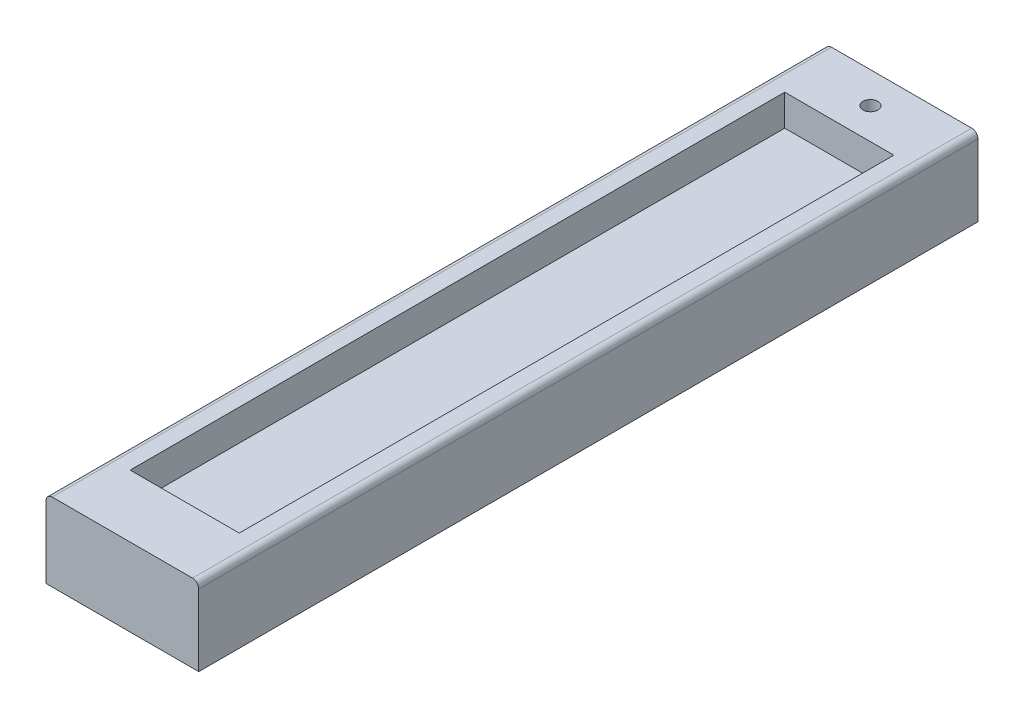
from build123d import *

# Parameters (mm, degrees)
SKETCH1_W               = 49
SKETCH1_H               = 20
BOSS_EXTRUDE1_DEPTH     = 125
SKETCH3_W               = 49
SKETCH3_H               = 250
BOSS_EXTRUDE2_DEPTH     = 5
CUT_EXTRUDE1_DEPTH      = 130.808512818
CUT_EXTRUDE1_DEPTH_BACK = 10
SKETCH2_R               = 2.4
SKETCH5_W               = 35
SKETCH5_H               = 210
CUT_EXTRUDE3_DEPTH      = 10
FILLET1_R               = 2
SKETCH4_R               = 7.874
CUT_EXTRUDE2_DEPTH      = 10


with BuildPart() as part:
    # Sketch1 → Boss-Extrude1 (new, symmetric)
    with BuildSketch(Plane.XY):
        Rectangle(SKETCH1_W, SKETCH1_H)
    extrude(amount=BOSS_EXTRUDE1_DEPTH, both=True)

    # Sketch3 → Boss-Extrude2 (add)
    with BuildSketch(Plane(origin=(0, 10, 0), x_dir=(1, 0, 0), z_dir=(0, 1, 0))):
        Rectangle(SKETCH3_W, SKETCH3_H)
    extrude(amount=BOSS_EXTRUDE2_DEPTH)

    # Sketch2 → Cut-Extrude1 (cut, two sides: drawn at the far end of the back side and taken through both)
    with BuildSketch(Plane(origin=(0, 15, 0), x_dir=(1, 0, 0), z_dir=(0, 1, 0)).offset(-CUT_EXTRUDE1_DEPTH_BACK)):
        with Locations((0, 115)):
            Circle(SKETCH2_R)
    extrude(amount=CUT_EXTRUDE1_DEPTH + CUT_EXTRUDE1_DEPTH_BACK, mode=Mode.SUBTRACT)

    # Sketch5 → Cut-Extrude3 (cut)
    with BuildSketch(Plane(origin=(0, 15, 0), x_dir=(1, 0, 0), z_dir=(0, 1, 0))):
        Rectangle(SKETCH5_W, SKETCH5_H)
    extrude(amount=-CUT_EXTRUDE3_DEPTH, mode=Mode.SUBTRACT)

    # Fillet1
    fillet1_edges = [part.edges().sort_by_distance(p)[0] for p in [
        (-24.5, 15, 0),
        (24.5, 15, 0),
    ]]
    fillet(fillet1_edges, radius=FILLET1_R)

    # Sketch4 → Cut-Extrude2 (cut)
    with BuildSketch(Plane.XZ.offset(10)):
        with Locations((-0.5, 110)):
            Circle(SKETCH4_R)
    extrude(amount=-CUT_EXTRUDE2_DEPTH, mode=Mode.SUBTRACT)


solid = part.part
